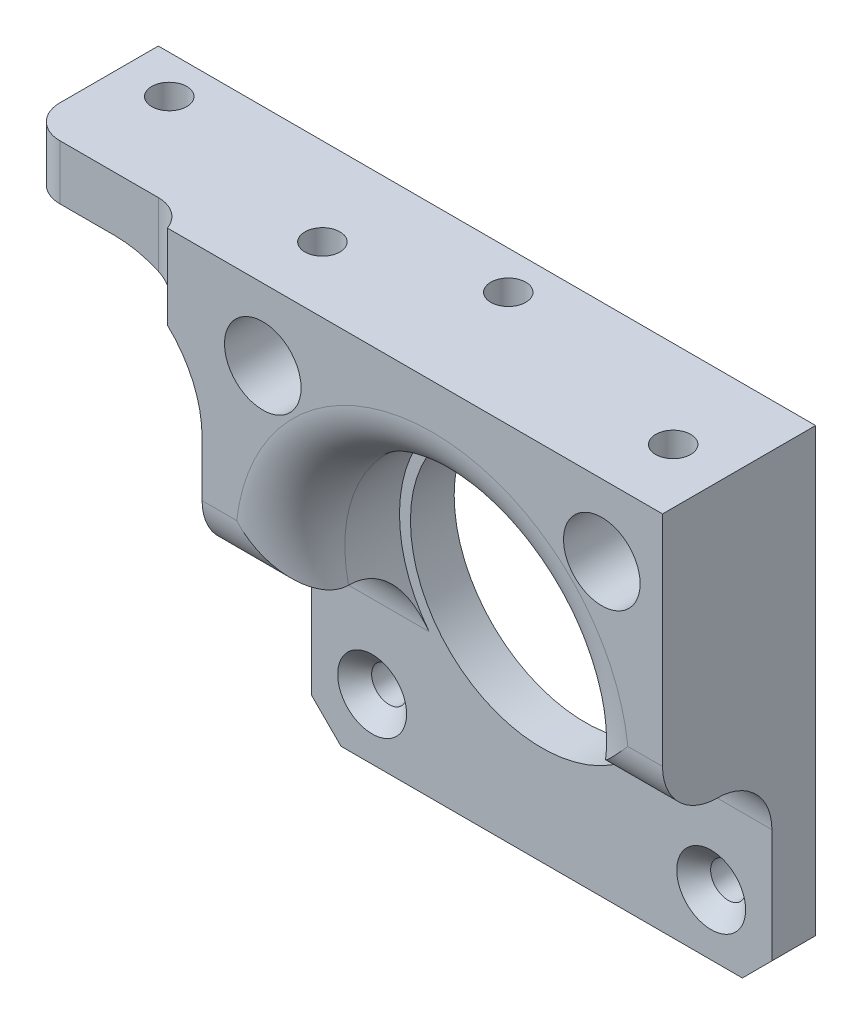
from build123d import *

# Parameters (mm, degrees)
ESBO_O1_W                                            = 42.10000000000001
ESBO_O1_H                                            = 42.10000000000002
RESSALTO_EXTRUS_O1_DEPTH                             = 4
ESBO_O2_R                                            = 12.000000000000007
CORTE_EXTRUS_O1_DEPTH                                = 8
ESCAREADO_PARA_PARAFUSO_DE_M_QUINA_COM_C_D           = 3.2
ESCAREADO_PARA_PARAFUSO_DE_M_QUINA_COM_C_CSINK_D     = 6.3
ESCAREADO_PARA_PARAFUSO_DE_M_QUINA_COM_C_CSINK_ANGLE = 90
RESSALTO_EXTRUS_O2_DEPTH                             = 10
ESBO_O6_R                                            = 3.5000000000000075
CORTE_EXTRUS_O2_DEPTH                                = 10.000000000000002
FURO_COM_FOLGA_DE_M31_D                              = 3.2
FILETE1_R                                            = 5
CORTE_EXTRUS_O6_DEPTH                                = 22.500000000000007
CHANFRO1_SIZE                                        = 2.7
SKETCH2_W                                            = 42.10000000000001
SKETCH2_H                                            = 14.000000000000002
SKETCH2_R                                            = 1.5999999999999908
BOSS_EXTRUDE1_DEPTH                                  = 1
RESSALTO_EXTRUS_O3_DEPTH                             = 5
FILETE3_R                                            = 10
ESBO_O17_R                                           = 1.5999999999999908
ESBO_O17_R_2                                         = 1.599999999999991
CORTE_EXTRUS_O8_DEPTH                                = 31
CORTE_EXTRUS_O9_DEPTH                                = 8
CORTE_EXTRUS_O9_DEPTH_BACK                           = 2


with BuildPart() as part:
    # Esboço1 → Ressalto-extrusão1 (new body)
    with BuildSketch(Plane.XY):
        with Locations((87.32270610713223, -330.71568115646056)):
            Rectangle(ESBO_O1_W, ESBO_O1_H)
    extrude(amount=RESSALTO_EXTRUS_O1_DEPTH)

    # Esboço2 → Corte-extrusão1 (cut)
    with BuildSketch(Plane.XY.offset(4)):
        with Locations((87.32270610713225, -330.71568115646056)):
            Circle(ESBO_O2_R)
    extrude(amount=-CORTE_EXTRUS_O1_DEPTH, mode=Mode.SUBTRACT)

    # Escareado para parafuso de máquina com cabeça chata de M31 (through all)
    with Locations(Plane.XY.offset(4)):
        with Locations((102.822706107, -346.215681156), (102.822706107, -315.215681156), (71.822706107, -315.215681156), (71.822706107, -346.215681156)):
            CounterSinkHole(ESCAREADO_PARA_PARAFUSO_DE_M_QUINA_COM_C_D / 2, ESCAREADO_PARA_PARAFUSO_DE_M_QUINA_COM_C_CSINK_D / 2, counter_sink_angle=ESCAREADO_PARA_PARAFUSO_DE_M_QUINA_COM_C_CSINK_ANGLE)

    # Esboço5 → Ressalto-extrusão2 (add)
    with BuildSketch(Plane.XY.offset(4)):
        with BuildLine():
            Line((99.98357100649832, -333.66568115646055), (108.37270610713225, -333.66568115646055))
            Line((108.37270610713225, -333.66568115646055), (108.37270610713225, -309.66568115646055))
            Line((108.37270610713225, -309.66568115646055), (66.27270610713224, -309.66568115646055))
            Line((66.27270610713224, -309.66568115646055), (66.27270610713224, -333.66568115646055))
            Line((66.27270610713224, -333.66568115646055), (74.66184120776617, -333.66568115646055))
            ThreePointArc((74.66184120776617, -333.66568115646055), (87.32270610713225, -317.71568115646056), (99.98357100649832, -333.66568115646055))
        make_face()
    extrude(amount=RESSALTO_EXTRUS_O2_DEPTH)

    # Esboço6 → Corte-extrusão2 (cut)
    with BuildSketch(Plane.XY.offset(14)):
        with Locations((71.82270610713223, -315.21568115646056)):
            Circle(ESBO_O6_R)
        with Locations((102.82270610713226, -315.21568115646056)):
            Circle(ESBO_O6_R)
    extrude(amount=-CORTE_EXTRUS_O2_DEPTH, mode=Mode.SUBTRACT)

    # Furo com folga de M31 (through all)
    with Locations(Plane(origin=(0, -309.66568115646055, 0), x_dir=(1, 0, 0), z_dir=(0, 1, 0))):
        with Locations((103.359135837, -8.012655369), (71.286276377, -8.012655369)):
            Hole(FURO_COM_FOLGA_DE_M31_D / 2)

    # Filete1
    # the kernel refuses this fillet: 5 mm, written as the material it adds along each edge
    with BuildSketch(Plane(origin=(87.48357100649832, -333.66568115646055, 4), x_dir=(0, -1, 0), z_dir=(1, 0, 0))) as filete1_piece_1_section:
        with BuildLine():
            CenterArc((FILETE1_R, -FILETE1_R), FILETE1_R, 90, 90)
            Line((0, -FILETE1_R), (0, 0))
            Line((0, 0), (FILETE1_R, 0))
        make_face()
    filete1_piece_1 = extrude(amount=20.889135100633922, mode=Mode.PRIVATE)
    filete1_piece_1 = filete1_piece_1 - Plane(origin=(87.32270610713225, -330.71568115646056, 5.015859225762799), x_dir=(-0.9739126845666216, -0.22692307692307614, 0), z_dir=(0, 0, -1)) * Cylinder(12.999999999999995, 62, mode=Mode.PRIVATE)
    filete1_piece_1 = filete1_piece_1 - Plane(origin=(103.359135837, -334.8905504329836, 8.012655369), x_dir=(-1, 0, 0), z_dir=(0, -1, 0)) * Cylinder(1.6, 62, mode=Mode.PRIVATE)
    add(filete1_piece_1)
    with BuildSketch(Plane(origin=(66.27270610713224, -333.66568115646055, 4), x_dir=(0, -1, 0), z_dir=(1, 0, 0))) as filete1_piece_2_section:
        with BuildLine():
            CenterArc((FILETE1_R, -FILETE1_R), FILETE1_R, 90, 90)
            Line((0, -FILETE1_R), (0, 0))
            Line((0, 0), (FILETE1_R, 0))
        make_face()
    filete1_piece_2 = extrude(amount=20.889135100633936, mode=Mode.PRIVATE)
    filete1_piece_2 = filete1_piece_2 - Plane(origin=(87.32270610713225, -330.71568115646056, 5.01585849038902), x_dir=(-0.9739126845666216, -0.22692307692307614, 0), z_dir=(0, 0, -1)) * Cylinder(12.999999999999995, 62, mode=Mode.PRIVATE)
    filete1_piece_2 = filete1_piece_2 - Plane(origin=(71.286276377, -334.8905494522985, 8.012655369), x_dir=(-1, 0, 0), z_dir=(0, -1, 0)) * Cylinder(1.6, 62, mode=Mode.PRIVATE)
    add(filete1_piece_2)
    # the kernel refuses this fillet: 5 mm, written as the material it takes off along each edge
    with BuildSketch(Plane(origin=(87.32270610713225, -330.71568115646056, 14), x_dir=(-0.36935058707522056, -0.9292901289840487, 0), z_dir=(0.9292901289840487, -0.36935058707522056, 0))) as filete1_2_piece_1:
        with BuildLine():
            CenterArc((12.999999999999979 + FILETE1_R, FILETE1_R), FILETE1_R, 180, 90)
            Line((12.999999999999979 + FILETE1_R, 0), (12.999999999999979, 0))
            Line((12.999999999999979, 0), (12.999999999999984, FILETE1_R))
        make_face()
    revolve(axis=Axis((87.32270610713225, -330.71568115646056, 14), (0, 0, -1)), revolution_arc=316.648856226302, mode=Mode.SUBTRACT)
    with BuildSketch(Plane(origin=(87.48357100649832, -333.66568115646055, 14), x_dir=(0, 0, -1), z_dir=(1, 0, 0))) as filete1_2_piece_2:
        with BuildLine():
            CenterArc((FILETE1_R, FILETE1_R), FILETE1_R, 180, 90)
            Line((0, FILETE1_R), (0, 0))
            Line((0, 0), (FILETE1_R, 0))
        make_face()
    extrude(amount=33.38913510063392, mode=Mode.SUBTRACT)
    with BuildSketch(Plane(origin=(53.77270610713224, -333.66568115646055, 14), x_dir=(0, 1, 0), z_dir=(1, 0, 0))) as filete1_2_piece_3:
        with BuildLine():
            CenterArc((FILETE1_R, -FILETE1_R), FILETE1_R, 90, 90)
            Line((0, -FILETE1_R), (0, 0))
            Line((0, 0), (FILETE1_R, 0))
        make_face()
    extrude(amount=33.389135100633936, mode=Mode.SUBTRACT)

    # Esboço13 → Corte-extrusão6 (cut)
    with BuildSketch(Plane.XZ.offset(351.7656811564606)):
        Polygon((74.0362763774125, 9.60036860941331), (71.28627637741243, 11.188081849684735), (68.53627637741243, 9.600368609413174), (68.53627637741253, 6.424942128870199), (71.2862763774126, 4.837228888598795), (74.03627637741259, 6.424942128870374), align=None)
        Polygon((106.10913583685199, 9.600368609413255), (103.35913583685196, 11.188081849684727), (100.60913583685196, 9.600368609413236), (100.60913583685199, 6.424942128870286), (103.359135836852, 4.837228888598834), (106.109135836852, 6.424942128870341), align=None)
    extrude(amount=-CORTE_EXTRUS_O6_DEPTH, mode=Mode.SUBTRACT)

    # Chanfro1
    chanfro1_edges = [part.edges().sort_by_distance(p)[0] for p in [
        (66.27270610713224, -351.7656811564606, 2),
        (108.37270610713225, -351.7656811564606, 2),
    ]]
    chamfer(chanfro1_edges, length=CHANFRO1_SIZE)

    # Sketch2 → Boss-Extrude1 (add)
    with BuildSketch(Plane(origin=(0, -309.66568115646055, 0), x_dir=(1, 0, 0), z_dir=(0, 1, 0))):
        with Locations((87.32270610713223, -7.000000000000001)):
            Rectangle(SKETCH2_W, SKETCH2_H)
        with Locations(Location((71.2862763774125, -8.012655369141836, 0), (0, 0, 270))):
            Circle(SKETCH2_R, mode=Mode.SUBTRACT)
        with Locations(Location((103.35913583685199, -8.012655369141836, 0), (0, 0, 270))):
            Circle(SKETCH2_R, mode=Mode.SUBTRACT)
    extrude(amount=BOSS_EXTRUDE1_DEPTH)

    # Esboço16 → Ressalto-extrusão3 (add)
    with BuildSketch(Plane.XZ.offset(308.6656811564605)):
        with BuildLine():
            Line((66.27270610713242, 0), (48.26899269713348, -2.2e-16))
            Line((48.26899269713348, -2.2e-16), (48.26899269713353, 9.000000000000064))
            ThreePointArc((48.26899269713353, 9.000000000000064), (49.147672353573896, 11.121320343559699), (51.268992697133534, 12.000000000000052))
            Line((51.268992697133534, 12.000000000000052), (60.2689926971336, 12.000000000000052))
            ThreePointArc((60.2689926971336, 12.000000000000052), (62.00104350470245, 12.550510257216857), (63.097419821879775, 14))
            Line((63.097419821879775, 14), (66.27270610713242, 14))
            Line((66.27270610713242, 14), (66.27270610713242, 0))
        make_face()
    extrude(amount=RESSALTO_EXTRUS_O3_DEPTH)

    # Filete3
    filete3_edges = [part.edges().sort_by_distance(p)[0] for p in [
        (66.27270610713227, -313.66568115646055, 7),
    ]]
    fillet(filete3_edges, radius=FILETE3_R)

    # Esboço17 → Corte-extrusão8 (cut)
    with BuildSketch(Plane(origin=(0, -308.66568115646055, 0), x_dir=(1, 0, 0), z_dir=(0, 1, 0))):
        with Locations(Location((83.76899269713277, -3.499999999999323, 0), (0, 0, 270))):
            Circle(ESBO_O17_R)
        with Locations(Location((52.76899269713277, -3.499999999999323, 0), (0, 0, 270))):
            Circle(ESBO_O17_R_2)
    extrude(amount=-CORTE_EXTRUS_O8_DEPTH, mode=Mode.SUBTRACT)

    # Esboço18 → Corte-extrusão9 (cut, two sides: drawn at the far end of the back side and taken through both)
    with BuildSketch(Plane.XZ.offset(313.6656811564605).offset(-CORTE_EXTRUS_O9_DEPTH_BACK)):
        Polygon((52.76899269713293, 6.674999999999326), (50.01936204011733, 5.087499999999323), (50.01936204011733, 1.9124999999993277), (52.76899269713293, 0.3249999999993254), (55.51862335414852, 1.9124999999993266), (55.51862335414852, 5.087499999999325), align=None)
        Polygon((83.76899269713292, 6.6749999999993275), (81.01936204011734, 5.087499999999328), (81.01936204011734, 1.9124999999993286), (83.76899269713293, 0.3249999999993267), (86.5186233541485, 1.9124999999993186), (86.5186233541485, 5.087499999999332), align=None)
    extrude(amount=CORTE_EXTRUS_O9_DEPTH + CORTE_EXTRUS_O9_DEPTH_BACK, mode=Mode.SUBTRACT)


solid = part.part
